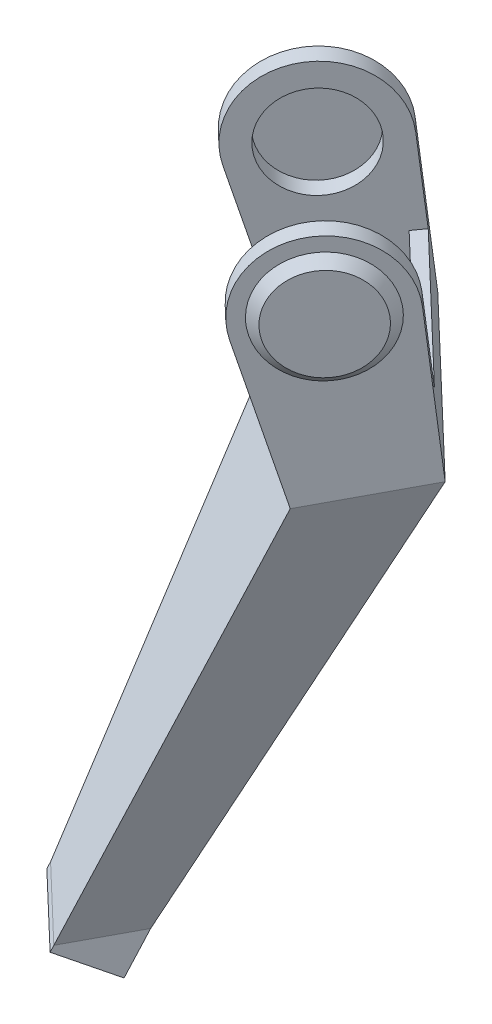
from build123d import *

# Parameters (mm, degrees)
SKETCH_2_R      = 10
EXTRUDE_1_DEPTH = 4
EXTRUDE_2_DEPTH = 46
SKETCH_5_W      = 22
SKETCH_5_H      = 12.287280664
EXTRUDE_3_DEPTH = 10
SKETCH_11_R     = 10
SKETCH_12_R     = 12


with BuildPart() as part:
    # 草图2 → 凸台-拉伸1 (new body)
    with BuildSketch(Plane(origin=(-16.453109388, 0, -15.72887915), x_dir=(-0.6910189439821498, 0, 0.7228366475613938), z_dir=(-0.7228366475613938, 0, -0.6910189439821498))):
        with BuildLine():
            Line((-132.709222702, 117.835300807), (-136.147009139, 85.228834816))
            Line((-136.147009139, 85.228834816), (-112.601036813, 80.58263344))
            Line((-112.601036813, 80.58263344), (-103.395289776, 112.050938471))
            ThreePointArc((-103.395289776, 112.050938471), (-114.8880285, 130.97876096), (-132.709222702, 117.835300807))
        make_face()
        with Locations((-117.79190436, 116.262528257)):
            Circle(SKETCH_2_R, mode=Mode.SUBTRACT)
    extrude_1 = extrude(amount=-EXTRUDE_1_DEPTH)

    # 草图3 → 凸台-拉伸2 (add)
    with BuildSketch(Plane(origin=(-13.561762798, 0, -12.964803374), x_dir=(0.6910189439821499, 0, -0.7228366475613937), z_dir=(0.7228366475613937, 0, 0.6910189439821499))):
        Polygon((136.147009139, 85.228834816), (134.609330081, 99.813300959), (131.70473303, 99.526798959), (132.697483817, 89.462153654), (111.241949113, 85.228447206), (112.601036813, 80.58263344), align=None)
    extrude(amount=EXTRUDE_2_DEPTH)

    # 放样2: read off the stored shape, not the designer's step
    # 放样2: loft between two sections, ruled curve by curve
    loft_2_from = [
        Edge.make_line((61.356340161, 80.58263344, -97.121035112), (77.627053093, 85.228834816, -114.140926811)),
        Edge.make_line((77.627053093, 85.228834816, -114.140926811), (113.768885471, 85.228834816, -79.589979612)),
        Edge.make_line((97.498172539, 80.58263344, -62.570087913), (61.356340161, 80.58263344, -97.121035112)),
        Edge.make_line((113.768885471, 85.228834816, -79.589979612), (97.498172539, 80.58263344, -62.570087913)),
    ]
    loft_2_to = [
        Edge.make_line((46.860844546, -10.027563198, -61.698163325), (57.030040129, -7.123687338, -72.335595637)),
        Edge.make_line((57.030040129, -7.123687338, -72.335595637), (72.932446375, -7.123687338, -57.133178869)),
        Edge.make_line((62.763250793, -10.027563198, -46.495746557), (46.860844546, -10.027563198, -61.698163325)),
        Edge.make_line((72.932446375, -7.123687338, -57.133178869), (62.763250793, -10.027563198, -46.495746557)),
    ]
    loft_2 = Solid(Shell([*[Face.make_surface_from_curves(loft_2_from[k], loft_2_to[k]) for k in range(4)], Face(Wire(loft_2_from)), Face(Wire(loft_2_to))]))
    add(loft_2)

    # 草图5 → 凸台-拉伸3 (add)
    with BuildSketch(Plane(origin=(8.529595319, 27.936892439, -8.92233728), x_dir=(0.7228366475613925, 0, 0.691018943982151), z_dir=(-0.27927155000623005, -0.9146951247190283, 0.29213050195479306))):
        with Locations((2.238136107, -80.608930106)):
            Rectangle(SKETCH_5_W, SKETCH_5_H)
    extrude(amount=EXTRUDE_3_DEPTH)

    # 草图11 → 放样3 section 0
    with BuildSketch(Plane(origin=(-17.898782683, 0, -17.110917038), x_dir=(-0.6910189439821499, 0, 0.7228366475613937), z_dir=(-0.7228366475613937, 0, -0.6910189439821499))):
        with Locations((-117.79190436, 116.262528257)):
            Circle(SKETCH_11_R)
    # 草图12 → 放样3 section 1
    with BuildSketch(Plane(origin=(-16.453109388, 0, -15.72887915), x_dir=(-0.6910189439821499, 0, 0.7228366475613937), z_dir=(-0.7228366475613937, 0, -0.6910189439821499))):
        with Locations((-117.79190436, 116.262528257)):
            Circle(SKETCH_12_R)
    loft_3 = loft()

    # 镜向2: 凸台-拉伸1, 放样3 across plane
    add(extrude_1.mirror(Plane(origin=(1.617806801, 0, 1.546594449), x_dir=(-0.6910189439821499, 0, 0.7228366475613937), z_dir=(0.7228366475613937, 0, 0.6910189439821499))))
    add(loft_3.mirror(Plane(origin=(1.617806801, 0, 1.546594449), x_dir=(-0.6910189439821499, 0, 0.7228366475613937), z_dir=(0.7228366475613937, 0, 0.6910189439821499))))


solid = part.part
